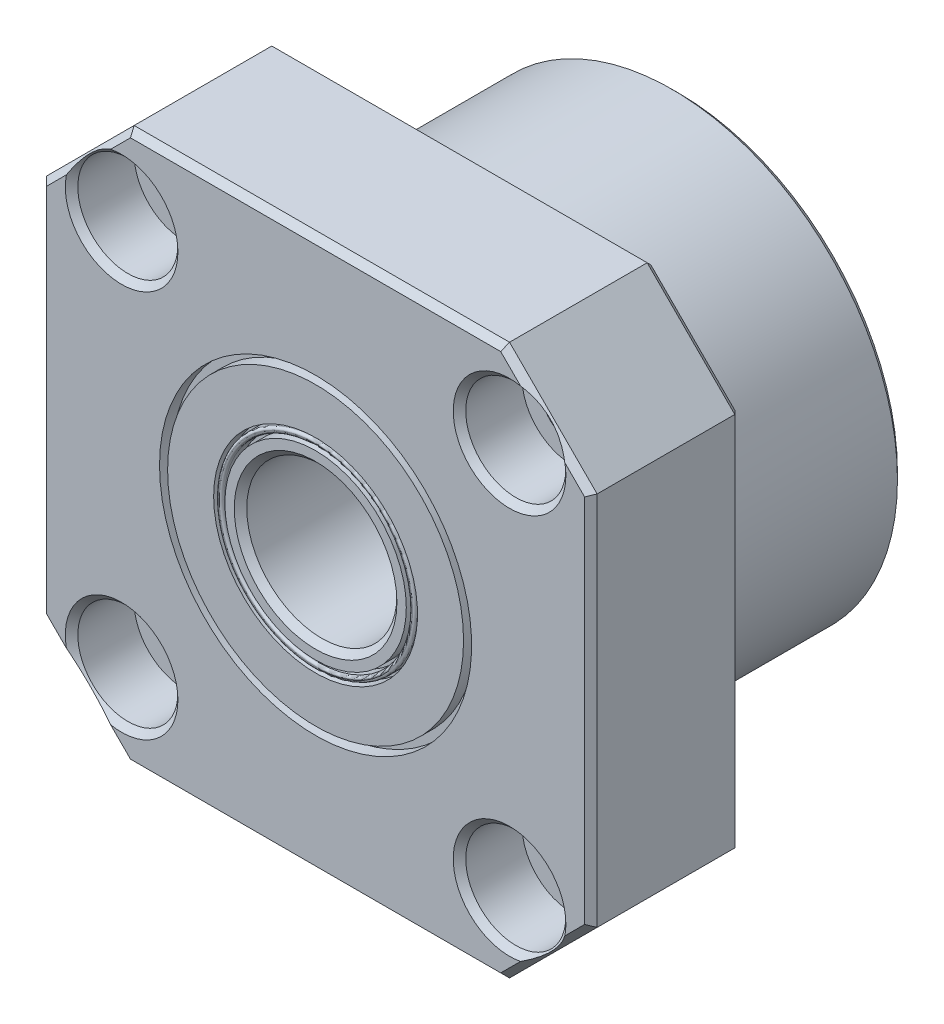
from build123d import *

# Parameters (mm, degrees)
ESBO_O1_W                  = 44
ESBO_O1_H                  = 44
RESSALTO_EXTRUS_O1_DEPTH   = 12
ESBO_O2_R                  = 18
RESSALTO_EXTRUS_O2_DEPTH   = 17
CHANFRO1_SIZE              = 7
CORTE_EXTRUS_O1_DEPTH      = 1
CORTE_EXTRUS_O1_DEPTH_BACK = 43.532340636
ESBO_O3_R                  = 6
ESBO_O3_R_2                = 2.5
ESBO_O4_R                  = 4
CORTE_EXTRUS_O2_DEPTH      = 5
CHANFRO2_SIZE              = 0.5
CHANFRO3_SIZE              = 0.5
ESBO_O5_R                  = 7.5
ESBO_O5_R_2                = 7.25
CORTE_EXTRUS_O3_DEPTH      = 1
ESBO_O6_R                  = 8.146724453
ESBO_O6_R_2                = 7.952420513
CORTE_EXTRUS_O4_DEPTH      = 1
ESBO_O7_R                  = 12.470388764
ESBO_O7_R_2                = 11.825568989
CORTE_EXTRUS_O5_DEPTH      = 1
FILETE1_R                  = 0.2
FILETE2_R                  = 0.2


with BuildPart() as part:
    # Esboço1 → Ressalto-extrusão1 (new body)
    with BuildSketch(Plane.XY):
        Rectangle(ESBO_O1_W, ESBO_O1_H)
    extrude(amount=RESSALTO_EXTRUS_O1_DEPTH)

    # Esboço2 → Ressalto-extrusão2 (add)
    with BuildSketch(Plane(origin=(0, 0, 0), x_dir=(-1, 0, 0), z_dir=(0, 0, -1))):
        with Locations(Location((0, 0, 0), (0, 0, 180))):
            Circle(ESBO_O2_R)
    extrude(amount=RESSALTO_EXTRUS_O2_DEPTH)

    # Chanfro1
    chanfro1_edges = [part.edges().sort_by_distance(p)[0] for p in [
        (-22, 22, 6),
        (22, 22, 6),
        (22, -22, 6),
        (-22, -22, 6),
    ]]
    chamfer(chanfro1_edges, length=CHANFRO1_SIZE)

    # Esboço3 → Corte-extrusão1 (cut, two sides: drawn at the far end of the back side and taken through both)
    with BuildSketch(Plane.XY.offset(12).offset(-CORTE_EXTRUS_O1_DEPTH_BACK)):
        Circle(ESBO_O3_R)
        with Locations((-15.5, 15.5)):
            Circle(ESBO_O3_R_2)
        with Locations((15.5, 15.5)):
            Circle(ESBO_O3_R_2)
        with Locations((15.5, -15.5)):
            Circle(ESBO_O3_R_2)
        with Locations((-15.5, -15.5)):
            Circle(ESBO_O3_R_2)
    extrude(amount=CORTE_EXTRUS_O1_DEPTH + CORTE_EXTRUS_O1_DEPTH_BACK, mode=Mode.SUBTRACT)

    # Esboço4 → Corte-extrusão2 (cut)
    with BuildSketch(Plane.XY.offset(12)):
        with Locations((-15.5, 15.5)):
            Circle(ESBO_O4_R)
        with Locations((15.5, 15.5)):
            Circle(ESBO_O4_R)
        with Locations((15.5, -15.5)):
            Circle(ESBO_O4_R)
        with Locations((-15.5, -15.5)):
            Circle(ESBO_O4_R)
    extrude(amount=-CORTE_EXTRUS_O2_DEPTH, mode=Mode.SUBTRACT)

    # Chanfro2
    # the kernel refuses this chamfer: 0.5 mm, written as the material it takes off along each edge
    with BuildSketch(Plane(origin=(0, 0, -17), x_dir=(1, 0, 0), z_dir=(0, 1, 0))) as chanfro2_piece_1:
        Polygon((18, -CHANFRO2_SIZE), (18 - CHANFRO2_SIZE, 0), (18, 0), align=None)
    revolve(axis=Axis((0, 0, -17), (0, 0, -1)), mode=Mode.SUBTRACT)
    with BuildSketch(Plane(origin=(16.285841494, -22, 12), x_dir=(0, 0.9996219169112968, 0.02749587661058555), z_dir=(-1, 0, 0)), Plane(origin=(-22, -16.285841494, 12), x_dir=(0.9996219169112968, 0, 0.02749587661058555), z_dir=(0, 1, 0)), Plane(origin=(22, 16.285841494, 12), x_dir=(-0.9996219169112968, 0, 0.02749587661058555), z_dir=(0, -1, 0))) as chanfro2_piece_2:
        Polygon((CHANFRO2_SIZE * 0.999621916911, CHANFRO2_SIZE * 0.0274958766106), (-CHANFRO2_SIZE * 0.0274958766106, CHANFRO2_SIZE * 0.999621916911), (0, 0), align=None)
    extrude(amount=32.571682988, mode=Mode.SUBTRACT)
    with BuildSketch(Plane(origin=(-16.285841494, 22, 12), x_dir=(0, 0.0274958766105891, -0.9996219169112968), z_dir=(1, 0, 0))) as chanfro2_piece_3:
        Polygon((CHANFRO2_SIZE * 0.999621916911, -CHANFRO2_SIZE * 0.0274958766106), (-CHANFRO2_SIZE * 0.0274958766106, -CHANFRO2_SIZE * 0.999621916911), (0, 0), align=None)
    extrude(amount=32.571682988, mode=Mode.SUBTRACT)
    with BuildSketch(Plane(origin=(-14.09077276, 22.90922724, 12), x_dir=(-0.019442520806015533, 0.019442520806015533, -0.9996219169112968), z_dir=(-0.7071067811865476, -0.7071067811865476, 0)), Plane(origin=(22.90922724, -14.09077276, 12), x_dir=(-0.7068394360706735, 0.7068394360706735, 0.02749587661058563), z_dir=(-0.7071067811865476, -0.7071067811865476, 0))) as chanfro2_piece_4:
        Polygon((CHANFRO2_SIZE * 0.999621916911, CHANFRO2_SIZE * 0.0274958766106), (-CHANFRO2_SIZE * 0.0274958766106, CHANFRO2_SIZE * 0.999621916911), (0, 0), align=None)
    extrude(amount=12.471177925, mode=Mode.SUBTRACT)
    with BuildSketch(Plane(origin=(14.09077276, 22.90922724, 12), x_dir=(0.019442520806015533, 0.019442520806015533, -0.9996219169112968), z_dir=(0.7071067811865476, -0.7071067811865476, 0)), Plane(origin=(-22.90922724, -14.09077276, 12), x_dir=(0.7068394360706735, 0.7068394360706735, 0.02749587661058563), z_dir=(0.7071067811865476, -0.7071067811865476, 0))) as chanfro2_piece_5:
        Polygon((CHANFRO2_SIZE * 0.999621916911, -CHANFRO2_SIZE * 0.0274958766106), (-CHANFRO2_SIZE * 0.0274958766106, -CHANFRO2_SIZE * 0.999621916911), (0, 0), align=None)
    extrude(amount=12.471177925, mode=Mode.SUBTRACT)
    with BuildSketch(Plane(origin=(0, 0, 12), x_dir=(1, 0, 0), z_dir=(0, -1, 0))) as chanfro2_piece_6:
        Polygon((6 + CHANFRO2_SIZE, 0), (6, -CHANFRO2_SIZE), (6, 0), align=None)
    revolve(axis=Axis((0, 0, 12), (0, 0, 1)), mode=Mode.SUBTRACT)
    with BuildSketch(Plane(origin=(0, 0, -17), x_dir=(1, 0, 0), z_dir=(0, -1, 0))) as chanfro2_piece_7:
        Polygon((6, CHANFRO2_SIZE), (6 + CHANFRO2_SIZE, 0), (6, 0), align=None)
    revolve(axis=Axis((0, 0, -17), (0, 0, 1)), mode=Mode.SUBTRACT)
    with BuildSketch(Plane(origin=(-15.5, 15.5, 12), x_dir=(1, 0, 0), z_dir=(0, -1, 0))) as chanfro2_piece_8:
        Polygon((4 + CHANFRO2_SIZE, 0), (4, -CHANFRO2_SIZE), (4, 0), align=None)
    revolve(axis=Axis((-15.5, 15.5, 12), (0, 0, 1)), mode=Mode.SUBTRACT)
    with BuildSketch(Plane(origin=(15.5, 15.5, 12), x_dir=(1, 0, 0), z_dir=(0, -1, 0))) as chanfro2_piece_9:
        Polygon((4 + CHANFRO2_SIZE, 0), (4, -CHANFRO2_SIZE), (4, 0), align=None)
    revolve(axis=Axis((15.5, 15.5, 12), (0, 0, 1)), mode=Mode.SUBTRACT)
    with BuildSketch(Plane(origin=(15.5, -15.5, 12), x_dir=(1, 0, 0), z_dir=(0, -1, 0))) as chanfro2_piece_10:
        Polygon((4 + CHANFRO2_SIZE, 0), (4, -CHANFRO2_SIZE), (4, 0), align=None)
    revolve(axis=Axis((15.5, -15.5, 12), (0, 0, 1)), mode=Mode.SUBTRACT)
    with BuildSketch(Plane(origin=(-15.5, -15.5, 12), x_dir=(1, 0, 0), z_dir=(0, -1, 0))) as chanfro2_piece_11:
        Polygon((4 + CHANFRO2_SIZE, 0), (4, -CHANFRO2_SIZE), (4, 0), align=None)
    revolve(axis=Axis((-15.5, -15.5, 12), (0, 0, 1)), mode=Mode.SUBTRACT)

    # Chanfro3
    chanfro3_edges = [part.edges().sort_by_distance(p)[0] for p in [
        (0, -22, 0),
        (-22, 0, 0),
        (0, 22, 0),
        (22, 0, 0),
        (-18.5, 18.5, 0),
        (18.5, 18.5, 0),
        (18.5, -18.5, 0),
        (-18.5, -18.5, 0),
    ]]
    chamfer(chanfro3_edges, length=CHANFRO3_SIZE)

    # Esboço5 → Corte-extrusão3 (cut)
    with BuildSketch(Plane(origin=(0, 0, -17), x_dir=(-1, 0, 0), z_dir=(0, 0, -1))):
        Circle(ESBO_O5_R)
        Circle(ESBO_O5_R_2, mode=Mode.SUBTRACT)
    corte_extrus_o3 = extrude(amount=-CORTE_EXTRUS_O3_DEPTH, mode=Mode.SUBTRACT)

    # Esboço6 → Corte-extrusão4 (cut)
    with BuildSketch(Plane(origin=(0, 0, -17), x_dir=(-1, 0, 0), z_dir=(0, 0, -1))):
        Circle(ESBO_O6_R)
        Circle(ESBO_O6_R_2, mode=Mode.SUBTRACT)
    corte_extrus_o4 = extrude(amount=-CORTE_EXTRUS_O4_DEPTH, mode=Mode.SUBTRACT)

    # Esboço7 → Corte-extrusão5 (cut)
    with BuildSketch(Plane(origin=(0, 0, -17), x_dir=(-1, 0, 0), z_dir=(0, 0, -1))):
        Circle(ESBO_O7_R)
        Circle(ESBO_O7_R_2, mode=Mode.SUBTRACT)
    corte_extrus_o5 = extrude(amount=-CORTE_EXTRUS_O5_DEPTH, mode=Mode.SUBTRACT)

    # Filete1
    filete1_edges = [part.edges().sort_by_distance(p)[0] for p in [
        (7.5, 0, -17),
        (7.952420513, 0, -17),
    ]]
    fillet(filete1_edges, radius=FILETE1_R)

    # Espelhar3: Corte-extrusão3, Corte-extrusão4, Corte-extrusão5 across plane
    add(corte_extrus_o3.mirror(Plane.XY.offset(-2.5)), mode=Mode.SUBTRACT)
    add(corte_extrus_o4.mirror(Plane.XY.offset(-2.5)), mode=Mode.SUBTRACT)
    add(corte_extrus_o5.mirror(Plane.XY.offset(-2.5)), mode=Mode.SUBTRACT)

    # Filete2
    filete2_edges = [part.edges().sort_by_distance(p)[0] for p in [
        (7.5, 0, 12),
        (7.952420513, 0, 12),
    ]]
    fillet(filete2_edges, radius=FILETE2_R)


solid = part.part
